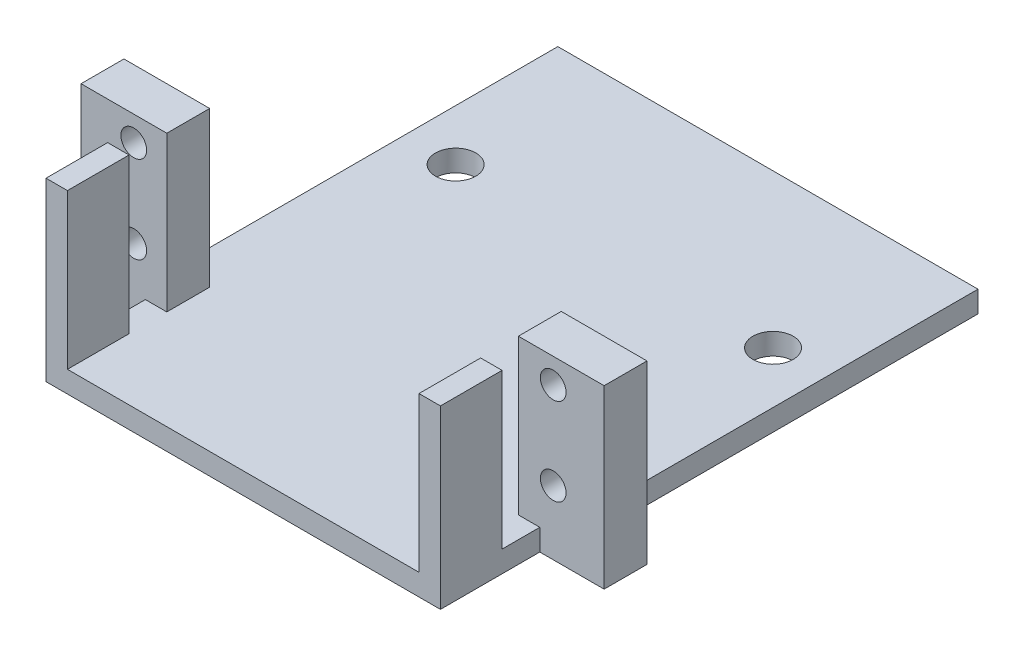
from build123d import *

# Parameters (mm, degrees)
SKETCH1_W           = 46
SKETCH1_H           = 36.614031046
BOSS_EXTRUDE1_DEPTH = 2.5
SKETCH2_W           = 2.5
SKETCH2_H           = 25.026075356
SKETCH2_H_2         = 7.18795569
BOSS_EXTRUDE2_DEPTH = 20.83511976
SKETCH4_W           = 10
SKETCH4_H           = 20.552854399
BOSS_EXTRUDE8_DEPTH = 5
SKETCH5_W           = 20.026075356
SKETCH5_H           = 23.33511976
CUT_EXTRUDE1_DEPTH  = 100
SKETCH6_W           = 49
SKETCH6_H           = 2.5
BOSS_EXTRUDE9_DEPTH = 44.601756686
SKETCH7_R           = 2.35
CUT_EXTRUDE2_DEPTH  = 57
SKETCH9_W           = 16.58795569
SKETCH9_H           = 2.782265361
CUT_EXTRUDE3_DEPTH  = 47
SKETCH10_R          = 1.5
CUT_EXTRUDE4_DEPTH  = 10


with BuildPart() as part:
    # Sketch1 → Boss-Extrude1 (new body)
    with BuildSketch(Plane(origin=(0, 0, 0), x_dir=(1, 0, 0), z_dir=(0, 1, 0))):
        with Locations((23, 18.307015523)):
            Rectangle(SKETCH1_W, SKETCH1_H)
    extrude(amount=BOSS_EXTRUDE1_DEPTH)

    # Sketch2 → Boss-Extrude2 (add)
    with BuildSketch(Plane(origin=(0, 2.5, 0), x_dir=(1, 0, 0), z_dir=(0, 1, 0))):
        with Locations((1.25, 24.100993368)):
            Rectangle(SKETCH2_W, SKETCH2_H)
        with Locations((1.25, 3.593977845)):
            Rectangle(SKETCH2_W, SKETCH2_H_2)
        with Locations((44.75, 3.593977845)):
            Rectangle(SKETCH2_W, SKETCH2_H_2)
        with Locations((44.75, 24.100993368)):
            Rectangle(SKETCH2_W, SKETCH2_H)
    extrude(amount=BOSS_EXTRUDE2_DEPTH)

    # Sketch4 → Boss-Extrude8 (add)
    with BuildSketch(Plane.XY.offset(-11.58795569)):
        with Locations((-2.5, 10.2764272)):
            Rectangle(SKETCH4_W, SKETCH4_H)
        with Locations((48.5, 10.2764272)):
            Rectangle(SKETCH4_W, SKETCH4_H)
    extrude(amount=-BOSS_EXTRUDE8_DEPTH)

    # Sketch5 → Cut-Extrude1 (cut)
    with BuildSketch(Plane.ZY):
        with Locations((-26.600993368, 11.66755988)):
            Rectangle(SKETCH5_W, SKETCH5_H)
    extrude(amount=-CUT_EXTRUDE1_DEPTH, mode=Mode.SUBTRACT)

    # Sketch6 → Boss-Extrude9 (add)
    with BuildSketch(Plane(origin=(0, 0, -16.58795569), x_dir=(-1, 0, 0), z_dir=(0, 0, -1))):
        with Locations((-23, 1.25)):
            Rectangle(SKETCH6_W, SKETCH6_H)
    extrude(amount=BOSS_EXTRUDE9_DEPTH)

    # Sketch7 → Cut-Extrude2 (cut)
    with BuildSketch(Plane(origin=(0, 2.5, 0), x_dir=(1, 0, 0), z_dir=(0, 1, 0))):
        with Locations((4.458214718, 43.313777074)):
            Circle(SKETCH7_R)
        with Locations((41.472783072, 43.313777074)):
            Circle(SKETCH7_R)
    extrude(amount=-CUT_EXTRUDE2_DEPTH, mode=Mode.SUBTRACT)

    # Sketch9 → Cut-Extrude3 (cut)
    with BuildSketch(Plane.ZY):
        with Locations((-8.293977845, 21.94398708)):
            Rectangle(SKETCH9_W, SKETCH9_H)
    extrude(amount=-CUT_EXTRUDE3_DEPTH, mode=Mode.SUBTRACT)

    # Sketch10 → Cut-Extrude4 (cut)
    with BuildSketch(Plane.XY.offset(-11.58795569)):
        with Locations((-1.353500868, 17.657737488)):
            Circle(SKETCH10_R)
        with Locations((-1.353500868, 7.492318257)):
            Circle(SKETCH10_R)
        with Locations((47.56068481, 17.657737488)):
            Circle(SKETCH10_R)
        with Locations((47.56068481, 7.492318257)):
            Circle(SKETCH10_R)
    extrude(amount=-CUT_EXTRUDE4_DEPTH, mode=Mode.SUBTRACT)


solid = part.part
